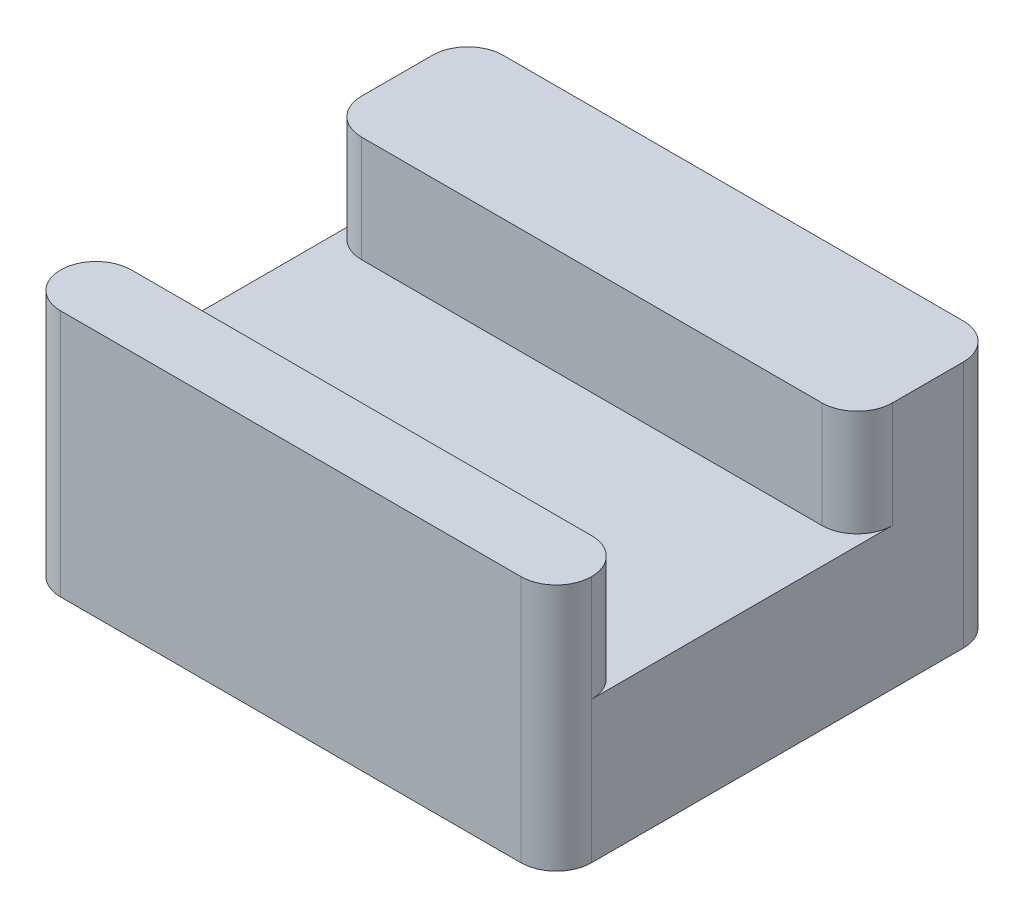
from build123d import *

# Parameters (mm, degrees)
SKETCH1_W           = 15
SKETCH1_H           = 12.5
BOSS_EXTRUDE1_DEPTH = 7
SKETCH2_W           = 15
SKETCH2_H           = 6.5
CUT_EXTRUDE2_DEPTH  = 3
SKETCH3_R           = 1.3
CUT_EXTRUDE3_DEPTH  = 10.5
FILLET1_R           = 1


with BuildPart() as part:
    # Sketch1 → Boss-Extrude1 (new body)
    with BuildSketch(Plane(origin=(0, 0, 0), x_dir=(1, 0, 0), z_dir=(0, 1, 0))):
        Rectangle(SKETCH1_W, SKETCH1_H)
    extrude(amount=BOSS_EXTRUDE1_DEPTH)

    # Sketch2 → Cut-Extrude2 (cut)
    with BuildSketch(Plane(origin=(0, 7, 0), x_dir=(1, 0, 0), z_dir=(0, 1, 0))):
        with Locations((0, -1)):
            Rectangle(SKETCH2_W, SKETCH2_H)
    extrude(amount=-CUT_EXTRUDE2_DEPTH, mode=Mode.SUBTRACT)

    # Sketch3 → Cut-Extrude3 (cut)
    with BuildSketch(Plane(origin=(0, 0, -6.25), x_dir=(-1, 0, 0), z_dir=(0, 0, -1))):
        with Locations((0, 2)):
            Circle(SKETCH3_R)
    extrude(amount=-CUT_EXTRUDE3_DEPTH, mode=Mode.SUBTRACT)

    # Fillet1
    fillet1_edges = [part.edges().sort_by_distance(p)[0] for p in [
        (7.5, 5.5, -2.25),
        (7.5, 5.5, 4.25),
        (-7.5, 5.5, 4.25),
        (-7.5, 5.5, -2.25),
        (7.5, 3.5, 6.25),
        (-7.5, 3.5, 6.25),
        (-7.5, 3.5, -6.25),
        (7.5, 3.5, -6.25),
    ]]
    fillet(fillet1_edges, radius=FILLET1_R - 0.0001)  # a hair under: the kernel refuses the full size


solid = part.part
